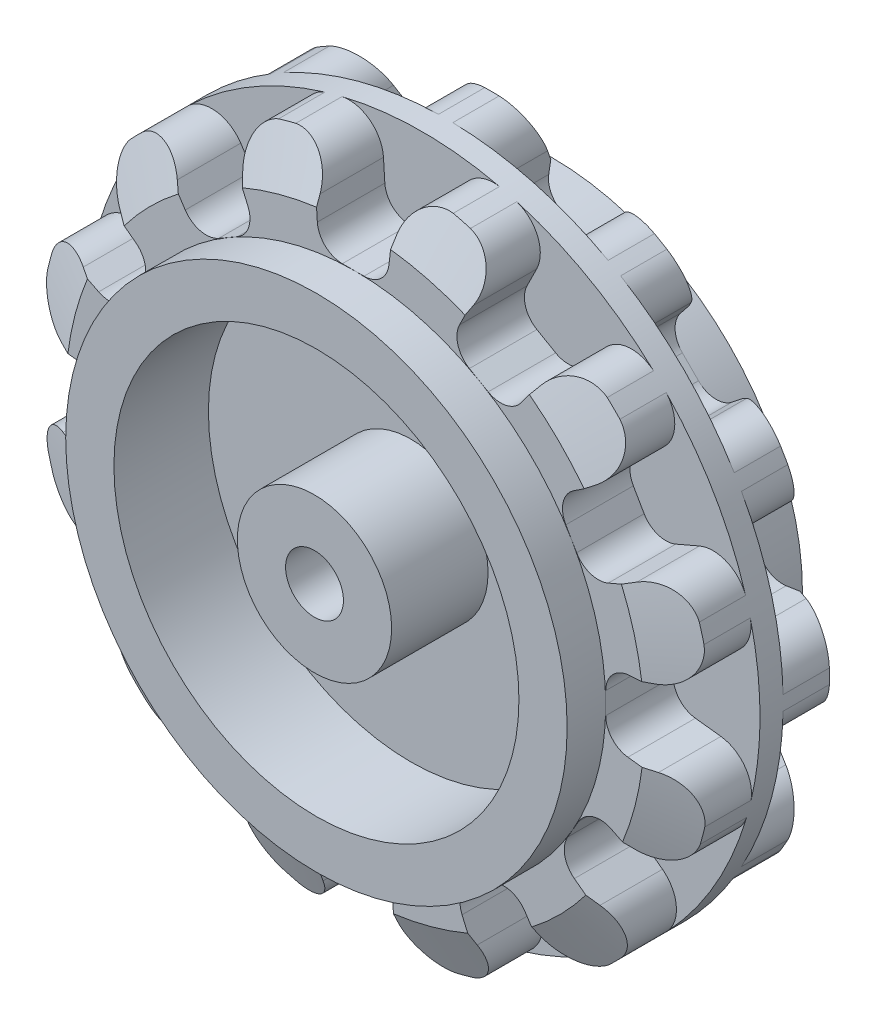
from build123d import *

# Parameters (mm, degrees)
ENL_V_MAT_EXTRU_2_DEPTH = 3.5
ENL_V_MAT_EXTRU_3_DEPTH = 3.5


with BuildPart() as part:
    # Esquisse2 → Révolution1 (revolve)
    with BuildSketch(Plane(origin=(0, 0, 0), x_dir=(1, 0, 0), z_dir=(0, 1, 0)), mode=Mode.PRIVATE) as r_volution1_sk:
        Polygon((-17.5, -4.957961783), (-17.5, 1.042038217), (-15, 2.142038217), (-13, 2.142038217), (-13, 4.142038217), (-10.5, 4.142038217), (-10.5, -0.757961783), (-4, -0.757961783), (-4, -0.057961783), (-1.5, -0.057961783), (-1.5, -0.757961783), (-1.5, -3.157961783), (-1.5, -8.157961783), (-4, -8.157961783), (-4, -3.157961783), (-10.5, -3.157961783), (-10.5, -8.057961783), (-13, -8.057961783), (-13, -6.057961783), (-15, -6.057961783), align=None)
    revolve(r_volution1_sk.sketch.rotate(Axis((0, 0, 0), (0, 0, -1)), 180), axis=Axis((0, 0, 0), (0, 0, -1)))

    # Esquisse3 → Enlèv. mat.-Extru.2 (cut)
    with BuildSketch(Plane.XY.offset(6.057961783)):
        Polygon((4.946471743, -18.460483863), (13.51401212, -13.51401212), (18.460483863, -4.946471743), (18.460483863, 4.946471743), (13.51401212, 13.51401212), (4.946471743, 18.460483863), (-4.946471743, 18.460483863), (-13.51401212, 13.51401212), (-18.460483863, 4.946471743), (-18.460483863, -4.946471743), (-13.51401212, -13.51401212), (-4.946471743, -18.460483863), align=None)
        with BuildLine():
            ThreePointArc((-1.952485794, 14.21859), (-1.545028101, 13.352415439), (-0.655037371, 13))
            Line((-0.655037371, 13), (0.467697688, 13))
            ThreePointArc((0.467697688, 13), (1.331672374, 13.328636144), (1.758826585, 14.148388091))
            Line((1.758826585, 14.148388091), (1.914232394, 15.471825882))
            ThreePointArc((1.914232394, 15.471825882), (2.691464168, 16.751505587), (4.16782361, 17.000568187))
            Line((4.16782361, 17.000568187), (4.7732793, 16.838336823))
            ThreePointArc((4.7732793, 16.838336823), (5.947993048, 15.840258561), (5.919551889, 14.299056527))
            Line((5.919551889, 14.299056527), (5.418392702, 13.289903044))
            ThreePointArc((5.418392702, 13.289903044), (5.338174134, 12.336045023), (5.932720997, 11.585848935))
            Line((5.932720997, 11.585848935), (6.905038079, 11.024481405))
            ThreePointArc((6.905038079, 11.024481405), (7.817580178, 10.877101311), (8.597382549, 11.373450217))
            Line((8.597382549, 11.373450217), (9.393686823, 12.44187806))
            ThreePointArc((9.393686823, 12.44187806), (10.706629136, 13.161497306), (12.109725218, 12.639012124))
            Line((12.109725218, 12.639012124), (12.552949545, 12.195787797))
            ThreePointArc((12.552949545, 12.195787797), (13.071242362, 10.744069792), (12.276010578, 9.423570259))
            Line((12.276010578, 9.423570259), (11.337417249, 8.800197299))
            ThreePointArc((11.337417249, 8.800197299), (10.791016922, 8.014241305), (10.930811564, 7.067279003))
            Line((10.930811564, 7.067279003), (11.492179093, 6.094961921))
            ThreePointArc((11.492179093, 6.094961921), (12.208773686, 5.511055966), (13.132276802, 5.551005542))
            Line((13.132276802, 5.551005542), (14.356110453, 6.078139059))
            ThreePointArc((14.356110453, 6.078139059), (15.852961474, 6.04487645), (16.806835733, 4.890842969))
            Line((16.806835733, 4.890842969), (16.969067097, 4.285387278))
            ThreePointArc((16.969067097, 4.285387278), (16.69206284, 2.769016199), (15.343122147, 2.023045949))
            Line((15.343122147, 2.023045949), (14.21859, 1.952485794))
            ThreePointArc((14.21859, 1.952485794), (13.352415439, 1.545028101), (13, 0.655037371))
            Line((13, 0.655037371), (13, -0.467697688))
            ThreePointArc((13, -0.467697688), (13.328636144, -1.331672374), (14.148388091, -1.758826585))
            Line((14.148388091, -1.758826585), (15.471825882, -1.914232394))
            ThreePointArc((15.471825882, -1.914232394), (16.751505587, -2.691464168), (17.000568187, -4.16782361))
            Line((17.000568187, -4.16782361), (16.838336823, -4.7732793))
            ThreePointArc((16.838336823, -4.7732793), (15.840258561, -5.947993048), (14.299056527, -5.919551889))
            Line((14.299056527, -5.919551889), (13.289903044, -5.418392702))
            ThreePointArc((13.289903044, -5.418392702), (12.336045023, -5.338174134), (11.585848935, -5.932720997))
            Line((11.585848935, -5.932720997), (11.024481405, -6.905038079))
            ThreePointArc((11.024481405, -6.905038079), (10.877101311, -7.817580178), (11.373450217, -8.597382549))
            Line((11.373450217, -8.597382549), (12.44187806, -9.393686823))
            ThreePointArc((12.44187806, -9.393686823), (13.161497306, -10.706629136), (12.639012124, -12.109725218))
            Line((12.639012124, -12.109725218), (12.195787797, -12.552949545))
            ThreePointArc((12.195787797, -12.552949545), (10.744069792, -13.071242362), (9.423570259, -12.276010578))
            Line((9.423570259, -12.276010578), (8.800197299, -11.337417249))
            ThreePointArc((8.800197299, -11.337417249), (8.014241305, -10.791016922), (7.067279003, -10.930811564))
            Line((7.067279003, -10.930811564), (6.094961921, -11.492179093))
            ThreePointArc((6.094961921, -11.492179093), (5.511055966, -12.208773686), (5.551005542, -13.132276802))
            Line((5.551005542, -13.132276802), (6.078139059, -14.356110453))
            ThreePointArc((6.078139059, -14.356110453), (6.04487645, -15.852961474), (4.890842969, -16.806835733))
            Line((4.890842969, -16.806835733), (4.285387278, -16.969067097))
            ThreePointArc((4.285387278, -16.969067097), (2.769016199, -16.69206284), (2.023045949, -15.343122147))
            Line((2.023045949, -15.343122147), (1.952485794, -14.21859))
            ThreePointArc((1.952485794, -14.21859), (1.545028101, -13.352415439), (0.655037371, -13))
            Line((0.655037371, -13), (-0.467697688, -13))
            ThreePointArc((-0.467697688, -13), (-1.331672374, -13.328636144), (-1.758826585, -14.148388091))
            Line((-1.758826585, -14.148388091), (-1.914232394, -15.471825882))
            ThreePointArc((-1.914232394, -15.471825882), (-2.691464168, -16.751505587), (-4.16782361, -17.000568187))
            Line((-4.16782361, -17.000568187), (-4.7732793, -16.838336823))
            ThreePointArc((-4.7732793, -16.838336823), (-5.947993048, -15.840258561), (-5.919551889, -14.299056527))
            Line((-5.919551889, -14.299056527), (-5.418392702, -13.289903044))
            ThreePointArc((-5.418392702, -13.289903044), (-5.338174134, -12.336045023), (-5.932720997, -11.585848935))
            Line((-5.932720997, -11.585848935), (-6.905038079, -11.024481405))
            ThreePointArc((-6.905038079, -11.024481405), (-7.817580178, -10.877101311), (-8.597382549, -11.373450217))
            Line((-8.597382549, -11.373450217), (-9.393686823, -12.44187806))
            ThreePointArc((-9.393686823, -12.44187806), (-10.706629136, -13.161497306), (-12.109725218, -12.639012124))
            Line((-12.109725218, -12.639012124), (-12.552949545, -12.195787797))
            ThreePointArc((-12.552949545, -12.195787797), (-13.071242362, -10.744069792), (-12.276010578, -9.423570259))
            Line((-12.276010578, -9.423570259), (-11.337417249, -8.800197299))
            ThreePointArc((-11.337417249, -8.800197299), (-10.791016922, -8.014241305), (-10.930811564, -7.067279003))
            Line((-10.930811564, -7.067279003), (-11.492179093, -6.094961921))
            ThreePointArc((-11.492179093, -6.094961921), (-12.208773686, -5.511055966), (-13.132276802, -5.551005542))
            Line((-13.132276802, -5.551005542), (-14.356110453, -6.078139059))
            ThreePointArc((-14.356110453, -6.078139059), (-15.852961474, -6.04487645), (-16.806835733, -4.890842969))
            Line((-16.806835733, -4.890842969), (-16.969067097, -4.285387278))
            ThreePointArc((-16.969067097, -4.285387278), (-16.69206284, -2.769016199), (-15.343122147, -2.023045949))
            Line((-15.343122147, -2.023045949), (-14.21859, -1.952485794))
            ThreePointArc((-14.21859, -1.952485794), (-13.352415439, -1.545028101), (-13, -0.655037371))
            Line((-13, -0.655037371), (-13, 0.467697688))
            ThreePointArc((-13, 0.467697688), (-13.328636144, 1.331672374), (-14.148388091, 1.758826585))
            Line((-14.148388091, 1.758826585), (-15.471825882, 1.914232394))
            ThreePointArc((-15.471825882, 1.914232394), (-16.751505587, 2.691464168), (-17.000568187, 4.16782361))
            Line((-17.000568187, 4.16782361), (-16.838336823, 4.7732793))
            ThreePointArc((-16.838336823, 4.7732793), (-15.840258561, 5.947993048), (-14.299056527, 5.919551889))
            Line((-14.299056527, 5.919551889), (-13.289903044, 5.418392702))
            ThreePointArc((-13.289903044, 5.418392702), (-12.336045023, 5.338174134), (-11.585848935, 5.932720997))
            Line((-11.585848935, 5.932720997), (-11.024481405, 6.905038079))
            ThreePointArc((-11.024481405, 6.905038079), (-10.877101311, 7.817580178), (-11.373450217, 8.597382549))
            Line((-11.373450217, 8.597382549), (-12.44187806, 9.393686823))
            ThreePointArc((-12.44187806, 9.393686823), (-13.161497306, 10.706629136), (-12.639012124, 12.109725218))
            Line((-12.639012124, 12.109725218), (-12.195787797, 12.552949545))
            ThreePointArc((-12.195787797, 12.552949545), (-10.744069792, 13.071242362), (-9.423570259, 12.276010578))
            Line((-9.423570259, 12.276010578), (-8.800197299, 11.337417249))
            ThreePointArc((-8.800197299, 11.337417249), (-8.014241305, 10.791016922), (-7.067279003, 10.930811564))
            Line((-7.067279003, 10.930811564), (-6.094961921, 11.492179093))
            ThreePointArc((-6.094961921, 11.492179093), (-5.511055966, 12.208773686), (-5.551005542, 13.132276802))
            Line((-5.551005542, 13.132276802), (-6.078139059, 14.356110453))
            ThreePointArc((-6.078139059, 14.356110453), (-6.04487645, 15.852961474), (-4.890842969, 16.806835733))
            Line((-4.890842969, 16.806835733), (-4.285387278, 16.969067097))
            ThreePointArc((-4.285387278, 16.969067097), (-2.769016199, 16.69206284), (-2.023045949, 15.343122147))
            Line((-2.023045949, 15.343122147), (-1.952485794, 14.21859))
        make_face(mode=Mode.SUBTRACT)
    extrude(amount=-ENL_V_MAT_EXTRU_2_DEPTH, mode=Mode.SUBTRACT)

    # Esquisse4 → Enlèv. mat.-Extru.3 (cut)
    with BuildSketch(Plane(origin=(0, 0, -2.142038217), x_dir=(-1, 0, 0), z_dir=(0, 0, -1))):
        Polygon((-9.893607139, -17.136230234), (0, -19.787214277), (9.893607139, -17.136230234), (17.136230234, -9.893607139), (19.787214277, 0), (17.136230234, 9.893607139), (9.893607139, 17.136230234), (0, 19.787214277), (-9.893607139, 17.136230234), (-17.136230234, 9.893607139), (-19.787214277, 0), (-17.136230234, -9.893607139), align=None)
        with BuildLine():
            ThreePointArc((-5.480913581, 13.182158464), (-4.85639589, 12.498648729), (-3.935380128, 12.404108418))
            Line((-3.935380128, 12.404108418), (-2.793915045, 12.709963065))
            ThreePointArc((-2.793915045, 12.709963065), (-2.043562153, 13.252345257), (-1.844468835, 14.156540897))
            Line((-1.844468835, 14.156540897), (-2.034342744, 15.435712567))
            ThreePointArc((-2.034342744, 15.435712567), (-1.616883535, 16.875645061), (-0.253850634, 17.5))
            Line((-0.253850634, 17.5), (0.253850634, 17.5))
            ThreePointArc((0.253850634, 17.5), (1.616883535, 16.875645061), (2.034342744, 15.435712567))
            Line((2.034342744, 15.435712567), (1.844468835, 14.156540897))
            ThreePointArc((1.844468835, 14.156540897), (2.043562153, 13.252345257), (2.793915045, 12.709963065))
            Line((2.793915045, 12.709963065), (3.935380128, 12.404108418))
            ThreePointArc((3.935380128, 12.404108418), (4.85639589, 12.498648729), (5.480913581, 13.182158464))
            Line((5.480913581, 13.182158464), (5.956063787, 14.384890581))
            ThreePointArc((5.956063787, 14.384890581), (7.037560314, 15.423179096), (8.530158902, 15.282369883))
            Line((8.530158902, 15.282369883), (8.969841098, 15.028519249))
            ThreePointArc((8.969841098, 15.028519249), (9.838084747, 13.806295561), (9.47964878, 12.350547837))
            Line((9.47964878, 12.350547837), (8.675627316, 11.337689629))
            ThreePointArc((8.675627316, 11.337689629), (8.395949367, 10.455086576), (8.774582937, 9.610193374))
            Line((8.774582937, 9.610193374), (9.610193374, 8.774582937))
            ThreePointArc((9.610193374, 8.774582937), (10.455086576, 8.395949367), (11.337689629, 8.675627316))
            Line((11.337689629, 8.675627316), (12.350547837, 9.47964878))
            ThreePointArc((12.350547837, 9.47964878), (13.806295561, 9.838084747), (15.028519249, 8.969841098))
            Line((15.028519249, 8.969841098), (15.282369883, 8.530158902))
            ThreePointArc((15.282369883, 8.530158902), (15.423179096, 7.037560314), (14.384890581, 5.956063787))
            Line((14.384890581, 5.956063787), (13.182158464, 5.480913581))
            ThreePointArc((13.182158464, 5.480913581), (12.498648729, 4.85639589), (12.404108418, 3.935380128))
            Line((12.404108418, 3.935380128), (12.709963065, 2.793915045))
            ThreePointArc((12.709963065, 2.793915045), (13.252345257, 2.043562153), (14.156540897, 1.844468835))
            Line((14.156540897, 1.844468835), (15.435712567, 2.034342744))
            ThreePointArc((15.435712567, 2.034342744), (16.875645061, 1.616883535), (17.5, 0.253850634))
            Line((17.5, 0.253850634), (17.5, -0.253850634))
            ThreePointArc((17.5, -0.253850634), (16.875645061, -1.616883535), (15.435712567, -2.034342744))
            Line((15.435712567, -2.034342744), (14.156540897, -1.844468835))
            ThreePointArc((14.156540897, -1.844468835), (13.252345257, -2.043562153), (12.709963065, -2.793915045))
            Line((12.709963065, -2.793915045), (12.404108418, -3.935380128))
            ThreePointArc((12.404108418, -3.935380128), (12.498648729, -4.85639589), (13.182158464, -5.480913581))
            Line((13.182158464, -5.480913581), (14.384890581, -5.956063787))
            ThreePointArc((14.384890581, -5.956063787), (15.423179096, -7.037560314), (15.282369883, -8.530158902))
            Line((15.282369883, -8.530158902), (15.028519249, -8.969841098))
            ThreePointArc((15.028519249, -8.969841098), (13.806295561, -9.838084747), (12.350547837, -9.47964878))
            Line((12.350547837, -9.47964878), (11.337689629, -8.675627316))
            ThreePointArc((11.337689629, -8.675627316), (10.455086576, -8.395949367), (9.610193374, -8.774582937))
            Line((9.610193374, -8.774582937), (8.774582937, -9.610193374))
            ThreePointArc((8.774582937, -9.610193374), (8.395949367, -10.455086576), (8.675627316, -11.337689629))
            Line((8.675627316, -11.337689629), (9.47964878, -12.350547837))
            ThreePointArc((9.47964878, -12.350547837), (9.838084747, -13.806295561), (8.969841098, -15.028519249))
            Line((8.969841098, -15.028519249), (8.530158902, -15.282369883))
            ThreePointArc((8.530158902, -15.282369883), (7.037560314, -15.423179096), (5.956063787, -14.384890581))
            Line((5.956063787, -14.384890581), (5.480913581, -13.182158464))
            ThreePointArc((5.480913581, -13.182158464), (4.85639589, -12.498648729), (3.935380128, -12.404108418))
            Line((3.935380128, -12.404108418), (2.793915045, -12.709963065))
            ThreePointArc((2.793915045, -12.709963065), (2.043562153, -13.252345257), (1.844468835, -14.156540897))
            Line((1.844468835, -14.156540897), (2.034342744, -15.435712567))
            ThreePointArc((2.034342744, -15.435712567), (1.616883535, -16.875645061), (0.253850634, -17.5))
            Line((0.253850634, -17.5), (-0.253850634, -17.5))
            ThreePointArc((-0.253850634, -17.5), (-1.616883535, -16.875645061), (-2.034342744, -15.435712567))
            Line((-2.034342744, -15.435712567), (-1.844468835, -14.156540897))
            ThreePointArc((-1.844468835, -14.156540897), (-2.043562153, -13.252345257), (-2.793915045, -12.709963065))
            Line((-2.793915045, -12.709963065), (-3.935380128, -12.404108418))
            ThreePointArc((-3.935380128, -12.404108418), (-4.85639589, -12.498648729), (-5.480913581, -13.182158464))
            Line((-5.480913581, -13.182158464), (-5.956063787, -14.384890581))
            ThreePointArc((-5.956063787, -14.384890581), (-7.037560314, -15.423179096), (-8.530158902, -15.282369883))
            Line((-8.530158902, -15.282369883), (-8.969841098, -15.028519249))
            ThreePointArc((-8.969841098, -15.028519249), (-9.838084747, -13.806295561), (-9.47964878, -12.350547837))
            Line((-9.47964878, -12.350547837), (-8.675627316, -11.337689629))
            ThreePointArc((-8.675627316, -11.337689629), (-8.395949367, -10.455086576), (-8.774582937, -9.610193374))
            Line((-8.774582937, -9.610193374), (-9.610193374, -8.774582937))
            ThreePointArc((-9.610193374, -8.774582937), (-10.455086576, -8.395949367), (-11.337689629, -8.675627316))
            Line((-11.337689629, -8.675627316), (-12.350547837, -9.47964878))
            ThreePointArc((-12.350547837, -9.47964878), (-13.806295561, -9.838084747), (-15.028519249, -8.969841098))
            Line((-15.028519249, -8.969841098), (-15.282369883, -8.530158902))
            ThreePointArc((-15.282369883, -8.530158902), (-15.423179096, -7.037560314), (-14.384890581, -5.956063787))
            Line((-14.384890581, -5.956063787), (-13.182158464, -5.480913581))
            ThreePointArc((-13.182158464, -5.480913581), (-12.498648729, -4.85639589), (-12.404108418, -3.935380128))
            Line((-12.404108418, -3.935380128), (-12.709963065, -2.793915045))
            ThreePointArc((-12.709963065, -2.793915045), (-13.252345257, -2.043562153), (-14.156540897, -1.844468835))
            Line((-14.156540897, -1.844468835), (-15.435712567, -2.034342744))
            ThreePointArc((-15.435712567, -2.034342744), (-16.875645061, -1.616883535), (-17.5, -0.253850634))
            Line((-17.5, -0.253850634), (-17.5, 0.253850634))
            ThreePointArc((-17.5, 0.253850634), (-16.875645061, 1.616883535), (-15.435712567, 2.034342744))
            Line((-15.435712567, 2.034342744), (-14.156540897, 1.844468835))
            ThreePointArc((-14.156540897, 1.844468835), (-13.252345257, 2.043562153), (-12.709963065, 2.793915045))
            Line((-12.709963065, 2.793915045), (-12.404108418, 3.935380128))
            ThreePointArc((-12.404108418, 3.935380128), (-12.498648729, 4.85639589), (-13.182158464, 5.480913581))
            Line((-13.182158464, 5.480913581), (-14.384890581, 5.956063787))
            ThreePointArc((-14.384890581, 5.956063787), (-15.423179096, 7.037560314), (-15.282369883, 8.530158902))
            Line((-15.282369883, 8.530158902), (-15.028519249, 8.969841098))
            ThreePointArc((-15.028519249, 8.969841098), (-13.806295561, 9.838084747), (-12.350547837, 9.47964878))
            Line((-12.350547837, 9.47964878), (-11.337689629, 8.675627316))
            ThreePointArc((-11.337689629, 8.675627316), (-10.455086576, 8.395949367), (-9.610193374, 8.774582937))
            Line((-9.610193374, 8.774582937), (-8.774582937, 9.610193374))
            ThreePointArc((-8.774582937, 9.610193374), (-8.395949367, 10.455086576), (-8.675627316, 11.337689629))
            Line((-8.675627316, 11.337689629), (-9.47964878, 12.350547837))
            ThreePointArc((-9.47964878, 12.350547837), (-9.838084747, 13.806295561), (-8.969841098, 15.028519249))
            Line((-8.969841098, 15.028519249), (-8.530158902, 15.282369883))
            ThreePointArc((-8.530158902, 15.282369883), (-7.037560314, 15.423179096), (-5.956063787, 14.384890581))
            Line((-5.956063787, 14.384890581), (-5.480913581, 13.182158464))
        make_face(mode=Mode.SUBTRACT)
    extrude(amount=-ENL_V_MAT_EXTRU_3_DEPTH, mode=Mode.SUBTRACT)


solid = part.part
